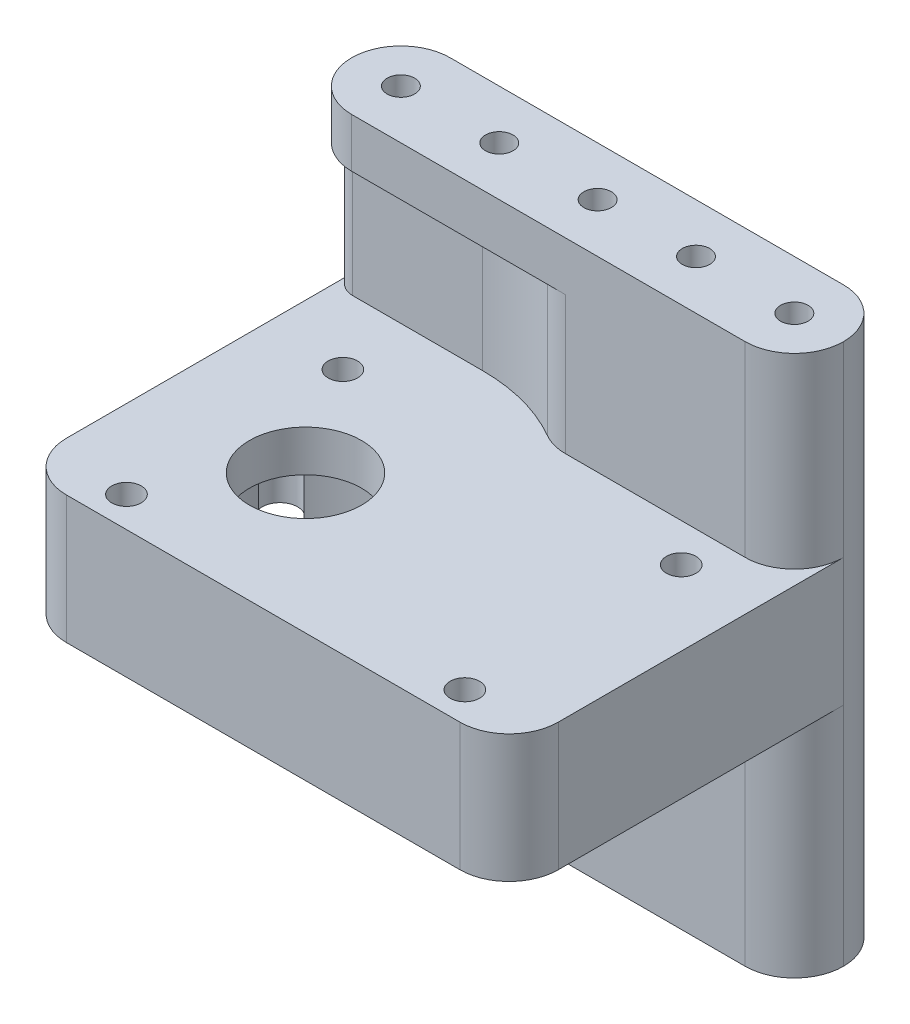
from build123d import *

# Parameters (mm, degrees)
SKETCH1_W             = 63.5
SKETCH1_H             = 12.7
SKETCH1_R             = 1.778
BOSS_EXTRUDE1_DEPTH   = 69.85
SKETCH2_W             = 63.5
SKETCH2_H             = 36.83
BOSS_EXTRUDE2_DEPTH   = 16.51
CAVITY1_START         = 29.21
CAVITY1_OUTLINE_R     = 1.143
CAVITY1_OUTLINE_R_2   = 4.445
CAVITY1_DEPTH         = 11.176
CAVITY1_2_OUTLINE_R   = 1.143
CAVITY1_2_OUTLINE_R_2 = 4.445
CAVITY1_2_DEPTH       = 1.016
CAVITY1_START_2       = 40.386
CAVITY1_3_OUTLINE_R   = 1.143
CAVITY1_3_OUTLINE_R_2 = 7.239
CAVITY1_3_DEPTH       = 5.334
CAVITY1_4_OUTLINE_R   = 4.445
CAVITY1_4_DEPTH       = 3.048
CAVITY1_START_3       = 30.226
CAVITY1_5_DEPTH       = 1.778
CAVITY1_START_4       = 42.418
CAVITY1_6_OUTLINE_R   = 1.905
CAVITY1_6_OUTLINE_R_2 = 1.143
CAVITY1_6_DEPTH       = 3.302
CAVITY1_7_OUTLINE_R   = 2.286
CAVITY1_7_DEPTH       = 1.27
CAVITY1_START_5       = 43.434
CAVITY1_8_DEPTH       = 0.254
CUT_EXTRUDE1_DEPTH    = 17.78
FILLET1_START         = -1
FILLET1_DEPTH         = 72
FILLET1_2_DEPTH       = 30.21
FILLET1_START_2       = 45.72
FILLET1_3_DEPTH       = 25.28
FILLET1_4_DEPTH       = 17.78
FILLET2_R             = 2.54


with BuildPart() as part:
    # Sketch1 → Boss-Extrude1 (new body)
    with BuildSketch(Plane(origin=(0, 0, 0), x_dir=(1, 0, 0), z_dir=(0, 1, 0))):
        with Locations((31.75, 6.35)):
            Rectangle(SKETCH1_W, SKETCH1_H)
        with Locations(Location((6.35, 6.35, 0), (0, 0, 270))):
            Circle(SKETCH1_R, mode=Mode.SUBTRACT)
        with Locations(Location((19.05, 6.35, 0), (0, 0, 270))):
            Circle(SKETCH1_R, mode=Mode.SUBTRACT)
        with Locations(Location((31.75, 6.35, 0), (0, 0, 270))):
            Circle(SKETCH1_R, mode=Mode.SUBTRACT)
        with Locations(Location((44.45, 6.35, 0), (0, 0, 270))):
            Circle(SKETCH1_R, mode=Mode.SUBTRACT)
        with Locations(Location((57.15, 6.35, 0), (0, 0, 270))):
            Circle(SKETCH1_R, mode=Mode.SUBTRACT)
    extrude(amount=BOSS_EXTRUDE1_DEPTH)

    # Sketch2 → Boss-Extrude2 (add)
    with BuildSketch(Plane(origin=(0, 45.72, 0), x_dir=(1, 0, 0), z_dir=(0, 1, 0))):
        with Locations((31.75, -18.415)):
            Rectangle(SKETCH2_W, SKETCH2_H)
    extrude(amount=-BOSS_EXTRUDE2_DEPTH)

    # Cavity1: read off the stored shape, not the designer's step
    # Cavity1 outline → Cavity1 (cut)
    with BuildSketch(Plane(origin=(0, 0, 0), x_dir=(1, 0, 0), z_dir=(0, 1, 0)).offset(CAVITY1_START)):
        with BuildLine():
            ThreePointArc((6.593811482, -12.259494253), (4.953, -18.923), (6.593811482, -25.586505747))
            ThreePointArc((6.593811482, -25.586505747), (5.264894786, -29.159847552), (9.073432496, -28.987128852))
            ThreePointArc((9.073432496, -28.987128852), (19.304, -33.274), (29.534567504, -28.987128852))
            ThreePointArc((29.534567504, -28.987128852), (33.343105214, -29.159847552), (32.014188518, -25.586505747))
            ThreePointArc((32.014188518, -25.586505747), (33.655, -18.923), (32.014188518, -12.259494253))
            ThreePointArc((32.014188518, -12.259494253), (33.343105214, -8.686152448), (29.534567504, -8.858871148))
            ThreePointArc((29.534567504, -8.858871148), (19.304, -4.572), (9.073432496, -8.858871148))
            ThreePointArc((9.073432496, -8.858871148), (5.264894786, -8.686152448), (6.593811482, -12.259494253))
        make_face()
        with Locations((10.16, -4.953)):
            Circle(CAVITY1_OUTLINE_R)
        with Locations((53.848, -4.953)):
            Circle(CAVITY1_OUTLINE_R)
        with Locations((10.16, -32.893)):
            Circle(CAVITY1_OUTLINE_R)
        with Locations((44.704, -18.923)):
            Circle(CAVITY1_OUTLINE_R_2)
        with Locations((53.848, -32.893)):
            Circle(CAVITY1_OUTLINE_R)
    extrude(amount=CAVITY1_DEPTH, mode=Mode.SUBTRACT)

    # Cavity1 2 outline → Cavity1 2 (cut)
    with BuildSketch(Plane(origin=(0, 0, 0), x_dir=(1, 0, 0), z_dir=(0, 1, 0)).offset(CAVITY1_START)):
        with BuildLine():
            ThreePointArc((6.731, -2.286), (4.216528286, -3.327528286), (3.175, -5.842))
            Line((3.175, -5.842), (3.175, -32.004))
            ThreePointArc((3.175, -32.004), (4.216528286, -34.518471714), (6.731, -35.56))
            Line((6.731, -35.56), (57.277, -35.56))
            ThreePointArc((57.277, -35.56), (59.791471714, -34.518471714), (60.833, -32.004))
            Line((60.833, -32.004), (60.833, -5.842))
            ThreePointArc((60.833, -5.842), (59.791471714, -3.327528286), (57.277, -2.286))
            Line((57.277, -2.286), (6.731, -2.286))
        make_face()
        with BuildLine():
            ThreePointArc((9.073432496, -8.858871148), (19.304, -4.572), (29.534567504, -8.858871148))
            ThreePointArc((29.534567504, -8.858871148), (33.343105214, -8.686152448), (32.014188518, -12.259494253))
            ThreePointArc((32.014188518, -12.259494253), (33.655, -18.923), (32.014188518, -25.586505747))
            ThreePointArc((32.014188518, -25.586505747), (33.343105214, -29.159847552), (29.534567504, -28.987128852))
            ThreePointArc((29.534567504, -28.987128852), (19.304, -33.274), (9.073432496, -28.987128852))
            ThreePointArc((9.073432496, -28.987128852), (5.264894786, -29.159847552), (6.593811482, -25.586505747))
            ThreePointArc((6.593811482, -25.586505747), (4.953, -18.923), (6.593811482, -12.259494253))
            ThreePointArc((6.593811482, -12.259494253), (5.264894786, -8.686152448), (9.073432496, -8.858871148))
        make_face(mode=Mode.SUBTRACT)
        with Locations((10.16, -4.953)):
            Circle(CAVITY1_2_OUTLINE_R, mode=Mode.SUBTRACT)
        with Locations((53.848, -4.953)):
            Circle(CAVITY1_2_OUTLINE_R, mode=Mode.SUBTRACT)
        with Locations((44.704, -18.923)):
            Circle(CAVITY1_2_OUTLINE_R_2, mode=Mode.SUBTRACT)
        with Locations((10.16, -32.893)):
            Circle(CAVITY1_2_OUTLINE_R, mode=Mode.SUBTRACT)
        with Locations((53.848, -32.893)):
            Circle(CAVITY1_2_OUTLINE_R, mode=Mode.SUBTRACT)
    extrude(amount=CAVITY1_2_DEPTH, mode=Mode.SUBTRACT)

    # Cavity1 3 outline → Cavity1 3 (cut)
    with BuildSketch(Plane(origin=(0, 0, 0), x_dir=(1, 0, 0), z_dir=(0, 1, 0)).offset(CAVITY1_START_2)):
        with Locations((10.16, -4.953)):
            Circle(CAVITY1_3_OUTLINE_R)
        with Locations((53.848, -4.953)):
            Circle(CAVITY1_3_OUTLINE_R)
        with Locations((10.16, -32.893)):
            Circle(CAVITY1_3_OUTLINE_R)
        with Locations((53.848, -32.893)):
            Circle(CAVITY1_3_OUTLINE_R)
        with Locations((19.304, -18.923)):
            Circle(CAVITY1_3_OUTLINE_R_2)
    extrude(amount=CAVITY1_3_DEPTH, mode=Mode.SUBTRACT)

    # Cavity1 4 outline → Cavity1 4 (cut)
    with BuildSketch(Plane(origin=(0, 0, 0), x_dir=(1, 0, 0), z_dir=(0, 1, 0)).offset(CAVITY1_START_2)):
        with BuildLine():
            ThreePointArc((33.190815, -22.54343784), (33.655, -18.923), (33.190815, -15.30256216))
            ThreePointArc((33.190815, -15.30256216), (28.194, -18.923), (33.190815, -22.54343784))
        make_face()
        with Locations((44.704, -18.923)):
            Circle(CAVITY1_4_OUTLINE_R)
    extrude(amount=CAVITY1_4_DEPTH, mode=Mode.SUBTRACT)

    # Cavity1 5 outline → Cavity1 5 (cut)
    with BuildSketch(Plane(origin=(0, 0, 0), x_dir=(1, 0, 0), z_dir=(0, 1, 0)).offset(CAVITY1_START_3)):
        with BuildLine():
            Line((43.693058667, -14.594487251), (45.602725966, -12.653238237))
            ThreePointArc((45.602725966, -12.653238237), (42.21166679, -14.341956381), (40.385648336, -17.661099029))
            Line((40.385648336, -17.661099029), (40.436941907, -17.677913564))
            ThreePointArc((40.436941907, -17.677913564), (41.647662495, -15.695489185), (43.693058667, -14.594487251))
        make_face()
        with BuildLine():
            ThreePointArc((52.371669641, -16.255765737), (49.592349777, -13.317455949), (45.602725966, -12.653238237))
            Line((45.602725966, -12.653238237), (43.693058667, -14.594487251))
            ThreePointArc((43.693058667, -14.594487251), (46.8188806, -15.013357427), (48.880068942, -17.40034666))
            Line((48.880068942, -17.40034666), (52.371669641, -16.255765737))
        make_face()
        with BuildLine():
            ThreePointArc((52.959, -18.923), (52.81042936, -17.557432759), (52.371669641, -16.255765737))
            Line((52.371669641, -16.255765737), (48.880068942, -17.40034666))
            ThreePointArc((48.880068942, -17.40034666), (49.081250932, -18.149889868), (49.149, -18.923))
            ThreePointArc((49.149, -18.923), (49.081250932, -19.696110132), (48.880068942, -20.44565334))
            Line((48.880068942, -20.44565334), (52.371669641, -21.590234263))
            ThreePointArc((52.371669641, -21.590234263), (52.81042936, -20.288567241), (52.959, -18.923))
        make_face()
        with BuildLine():
            Line((40.436941907, -17.677913564), (40.385648336, -17.661099029))
            ThreePointArc((40.385648336, -17.661099029), (40.35204351, -17.839950842), (40.323577582, -18.019692174))
            Line((40.323577582, -18.019692174), (40.359488936, -17.983186925))
            ThreePointArc((40.359488936, -17.983186925), (40.395510846, -17.829864048), (40.436941907, -17.677913564))
        make_face()
        with BuildLine():
            ThreePointArc((45.602725967, -25.192761763), (49.592349777, -24.528544051), (52.371669641, -21.590234263))
            Line((52.371669641, -21.590234263), (48.880068942, -20.44565334))
            ThreePointArc((48.880068942, -20.44565334), (46.8188806, -22.832642573), (43.693058668, -23.25151275))
            Line((43.693058668, -23.25151275), (45.602725967, -25.192761763))
        make_face()
        with BuildLine():
            Line((40.359488936, -17.983186925), (40.323577582, -18.019692174))
            ThreePointArc((40.323577582, -18.019692174), (40.275164971, -18.470193393), (40.259, -18.923))
            ThreePointArc((40.259, -18.923), (40.284193631, -18.450414917), (40.359488936, -17.983186925))
        make_face()
        with BuildLine():
            Line((40.359488936, -19.862813075), (40.323577582, -19.826307826))
            ThreePointArc((40.323577582, -19.826307826), (40.35204351, -20.006049158), (40.385648336, -20.184900971))
            Line((40.385648336, -20.184900971), (40.436941907, -20.168086436))
            ThreePointArc((40.436941907, -20.168086436), (40.395510846, -20.016135951), (40.359488936, -19.862813075))
        make_face()
        with BuildLine():
            ThreePointArc((40.259, -18.923), (40.275164971, -19.375806607), (40.323577582, -19.826307826))
            Line((40.323577582, -19.826307826), (40.359488936, -19.862813075))
            ThreePointArc((40.359488936, -19.862813075), (40.284193631, -19.395585083), (40.259, -18.923))
        make_face()
        with BuildLine():
            ThreePointArc((40.385648336, -20.184900971), (42.21166679, -23.504043619), (45.602725967, -25.192761763))
            Line((45.602725967, -25.192761763), (43.693058668, -23.25151275))
            ThreePointArc((43.693058668, -23.25151275), (41.647662496, -22.150510815), (40.436941907, -20.168086436))
            Line((40.436941907, -20.168086436), (40.385648336, -20.184900971))
        make_face()
    extrude(amount=CAVITY1_5_DEPTH, mode=Mode.SUBTRACT)

    # Cavity1 6 outline → Cavity1 6 (cut)
    # profile 1 of 4: a face of its own
    with BuildSketch(Plane(origin=(0, 0, 0), x_dir=(1, 0, 0), z_dir=(0, 1, 0)).offset(CAVITY1_START_4)):
        with Locations((10.16, -4.953)):
            Circle(CAVITY1_6_OUTLINE_R)
        with Locations((10.16, -4.953)):
            Circle(CAVITY1_6_OUTLINE_R_2, mode=Mode.SUBTRACT)
    # profile 2 of 4: a face of its own
    with BuildSketch(Plane(origin=(0, 0, 0), x_dir=(1, 0, 0), z_dir=(0, 1, 0)).offset(CAVITY1_START_4)):
        with Locations((53.848, -4.953)):
            Circle(CAVITY1_6_OUTLINE_R)
        with Locations((53.848, -4.953)):
            Circle(CAVITY1_6_OUTLINE_R_2, mode=Mode.SUBTRACT)
    # profile 3 of 4: a face of its own
    with BuildSketch(Plane(origin=(0, 0, 0), x_dir=(1, 0, 0), z_dir=(0, 1, 0)).offset(CAVITY1_START_4)):
        with Locations((10.16, -32.893)):
            Circle(CAVITY1_6_OUTLINE_R)
        with Locations((10.16, -32.893)):
            Circle(CAVITY1_6_OUTLINE_R_2, mode=Mode.SUBTRACT)
    # profile 4 of 4: a face of its own
    with BuildSketch(Plane(origin=(0, 0, 0), x_dir=(1, 0, 0), z_dir=(0, 1, 0)).offset(CAVITY1_START_4)):
        with Locations((53.848, -32.893)):
            Circle(CAVITY1_6_OUTLINE_R)
        with Locations((53.848, -32.893)):
            Circle(CAVITY1_6_OUTLINE_R_2, mode=Mode.SUBTRACT)
    extrude(amount=CAVITY1_6_DEPTH, mode=Mode.SUBTRACT)

    # Cavity1 7 outline → Cavity1 7 (cut)
    with BuildSketch(Plane(origin=(0, 0, 0), x_dir=(1, 0, 0), z_dir=(0, 1, 0)).offset(CAVITY1_START_2)):
        with Locations((7.112, -10.033)):
            Circle(CAVITY1_7_OUTLINE_R)
        with Locations((31.496, -10.033)):
            Circle(CAVITY1_7_OUTLINE_R)
        with Locations((7.112, -27.813)):
            Circle(CAVITY1_7_OUTLINE_R)
        with Locations((31.496, -27.813)):
            Circle(CAVITY1_7_OUTLINE_R)
    extrude(amount=CAVITY1_7_DEPTH, mode=Mode.SUBTRACT)

    # Cavity1 8 outline → Cavity1 8 (cut)
    with BuildSketch(Plane(origin=(0, 0, 0), x_dir=(1, 0, 0), z_dir=(0, 1, 0)).offset(CAVITY1_START_5)):
        with BuildLine():
            ThreePointArc((33.190815, -22.54343784), (33.655, -18.923), (33.190815, -15.30256216))
            ThreePointArc((33.190815, -15.30256216), (28.194, -18.923), (33.190815, -22.54343784))
        make_face()
    extrude(amount=CAVITY1_8_DEPTH, mode=Mode.SUBTRACT)

    # Sketch3 → Cut-Extrude1 (cut)
    with BuildSketch(Plane(origin=(0, 45.72, 0), x_dir=(1, 0, 0), z_dir=(0, 1, 0))):
        with BuildLine():
            Line((19.304, 3.937), (0, 3.937))
            Line((0, 3.937), (0, -6.678197674))
            ThreePointArc((0, -6.678197674), (30.319067381, -38.954172971), (19.304, 3.937))
        make_face()
    extrude(amount=CUT_EXTRUDE1_DEPTH, mode=Mode.SUBTRACT)

    # Fillet1: read off the stored shape, not the designer's step
    # Fillet1 outline → Fillet1 (cut)
    with BuildSketch(Plane(origin=(0, 0, 0), x_dir=(1, 0, 0), z_dir=(0, 1, 0)).offset(FILLET1_START)):
        with BuildLine():
            Line((0, 12.7), (0, 6.35))
            ThreePointArc((0, 6.35), (1.859871939, 10.840128061), (6.35, 12.7))
            Line((6.35, 12.7), (0, 12.7))
        make_face()
        with BuildLine():
            ThreePointArc((6.35, -36.83), (1.859871939, -34.970128061), (0, -30.48))
            Line((0, -30.48), (0, -36.83))
            Line((0, -36.83), (6.35, -36.83))
        make_face()
        with BuildLine():
            Line((63.5, 12.7), (57.15, 12.7))
            ThreePointArc((57.15, 12.7), (61.640128061, 10.840128061), (63.5, 6.35))
            Line((63.5, 6.35), (63.5, 12.7))
        make_face()
        with BuildLine():
            ThreePointArc((63.5, -30.48), (61.640128061, -34.970128061), (57.15, -36.83))
            Line((57.15, -36.83), (63.5, -36.83))
            Line((63.5, -36.83), (63.5, -30.48))
        make_face()
    extrude(amount=FILLET1_DEPTH, mode=Mode.SUBTRACT)

    # Fillet1 2 outline → Fillet1 2 (cut)
    with BuildSketch(Plane(origin=(0, 0, 0), x_dir=(1, 0, 0), z_dir=(0, 1, 0)).offset(FILLET1_START)):
        with BuildLine():
            Line((0, 0), (6.35, 0))
            ThreePointArc((6.35, 0), (1.859871939, 1.859871939), (0, 6.35))
            Line((0, 6.35), (0, 0))
        make_face()
        with BuildLine():
            ThreePointArc((63.5, 6.35), (61.640128061, 1.859871939), (57.15, 0))
            Line((57.15, 0), (63.5, 0))
            Line((63.5, 0), (63.5, 6.35))
        make_face()
    extrude(amount=FILLET1_2_DEPTH, mode=Mode.SUBTRACT)

    # Fillet1 3 outline → Fillet1 3 (cut)
    with BuildSketch(Plane(origin=(0, 0, 0), x_dir=(1, 0, 0), z_dir=(0, 1, 0)).offset(FILLET1_START_2)):
        with BuildLine():
            Line((0, 0), (6.35, 0))
            ThreePointArc((6.35, 0), (1.859871939, 1.859871939), (0, 6.35))
            Line((0, 6.35), (0, 0))
        make_face()
        with BuildLine():
            ThreePointArc((63.5, 6.35), (61.640128061, 1.859871939), (57.15, 0))
            Line((57.15, 0), (63.5, 0))
            Line((63.5, 0), (63.5, 6.35))
        make_face()
    extrude(amount=FILLET1_3_DEPTH, mode=Mode.SUBTRACT)

    # Fillet1 4 outline → Fillet1 4 (cut)
    with BuildSketch(Plane(origin=(0, 0, 0), x_dir=(1, 0, 0), z_dir=(0, 1, 0)).offset(FILLET1_START_2)):
        with BuildLine():
            ThreePointArc((30.765933464, 0.855869565), (31.455375612, 0.439945818), (32.129742513, 0))
            Line((32.129742513, 0), (33.94980387, 0))
            ThreePointArc((33.94980387, 0), (32.301354335, 0.217699116), (30.765933464, 0.855869565))
        make_face()
    extrude(amount=FILLET1_4_DEPTH, mode=Mode.SUBTRACT)

    # Fillet2
    # the kernel refuses this fillet: 2.54 mm, written as the material it takes off along each edge
    with BuildSketch(Plane(origin=(0.476335811, 63.5, -3.937), x_dir=(-0.17728630931640466, 0, -0.9841593186720166), z_dir=(0, -1, 0))) as fillet2_piece_1:
        with BuildLine():
            CenterArc((2.133529901, 2.483365284), FILLET2_R, 190.211734726, 91.910213196)
            Line((-0.366234768, 2.033058059), (0, 0))
            ThreePointArc((0, 0), (1.333456188, -0.141586789), (2.666912377, 0))
        make_face()
    extrude(amount=17.78, mode=Mode.SUBTRACT)


solid = part.part
